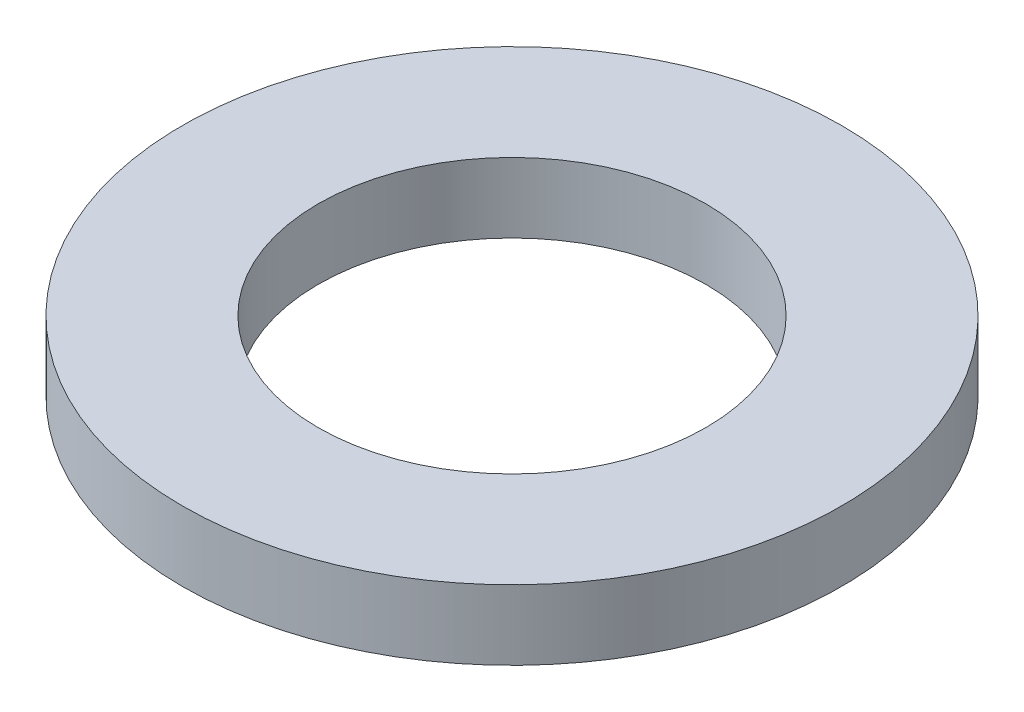
from build123d import *

# Parameters (mm, degrees)
SKETCH1_R           = 85
BOSS_EXTRUDE1_DEPTH = 18
SKETCH2_R           = 50
CUT_EXTRUDE1_DEPTH  = 122.548344291


with BuildPart() as part:
    # Sketch1 → Boss-Extrude1 (new body)
    with BuildSketch(Plane(origin=(0, 0, 0), x_dir=(1, 0, 0), z_dir=(0, 1, 0))):
        Circle(SKETCH1_R)
    extrude(amount=BOSS_EXTRUDE1_DEPTH)

    # Sketch2 → Cut-Extrude1 (cut, through all)
    with BuildSketch(Plane(origin=(0, 0, 0), x_dir=(1, 0, 0), z_dir=(0, 1, 0))):
        Circle(SKETCH2_R)
    extrude(amount=CUT_EXTRUDE1_DEPTH, mode=Mode.SUBTRACT)


solid = part.part
